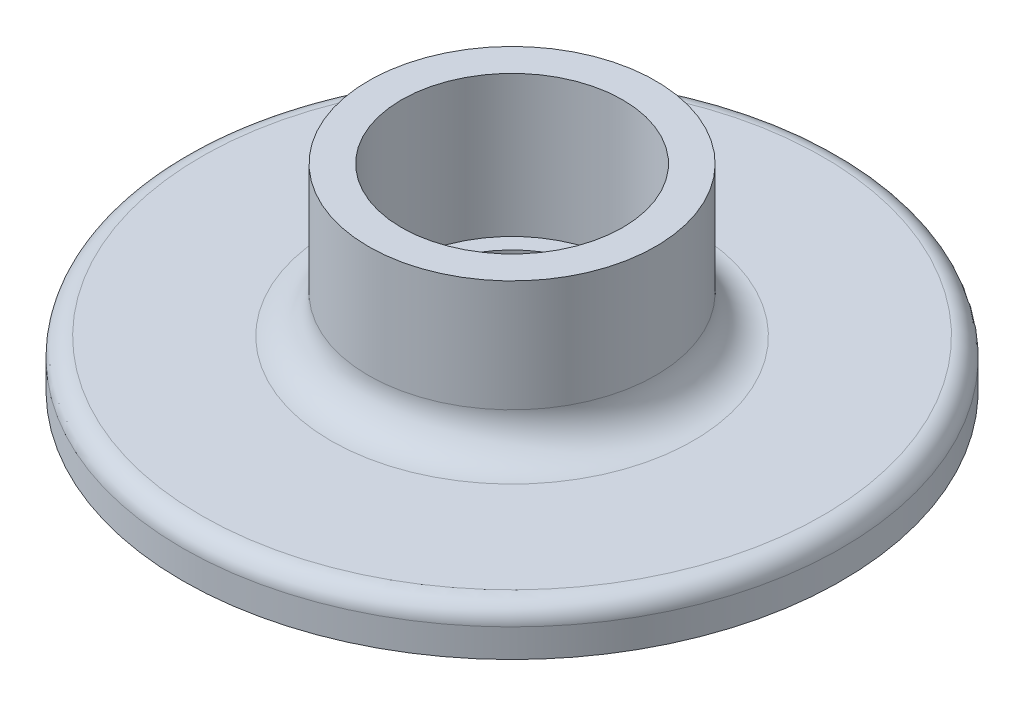
from build123d import *


with BuildPart() as part:
    # Sketch1 → Revolve1 (revolve)
    with BuildSketch(Plane.XY):
        with BuildLine():
            Line((-70, -26.698290186), (-45, -26.698290186))
            Line((-45, -26.698290186), (-45, -31.698290186))
            Line((-45, -31.698290186), (-40, -31.698290186))
            Line((-40, -31.698290186), (-40, -26.698290186))
            Line((-40, -26.698290186), (-20, -26.698290186))
            Line((-20, -26.698290186), (-20, -14.981775429))
            Line((-20, -14.981775429), (-23.5, -14.981775429))
            Line((-23.5, -14.981775429), (-23.5, 15.018224571))
            Line((-23.5, 15.018224571), (-30.5, 15.018224571))
            Line((-30.5, 15.018224571), (-30.5, -8.698290186))
            ThreePointArc((-30.5, -8.698290186), (-32.843145751, -14.355144435), (-38.5, -16.698290186))
            Line((-38.5, -16.698290186), (-66, -16.698290186))
            ThreePointArc((-66, -16.698290186), (-68.828427125, -17.869863061), (-70, -20.698290186))
            Line((-70, -20.698290186), (-70, -26.698290186))
        make_face()
    revolve(axis=Axis((0, 95.786399453, 0), (0, -1, 0)))


solid = part.part
